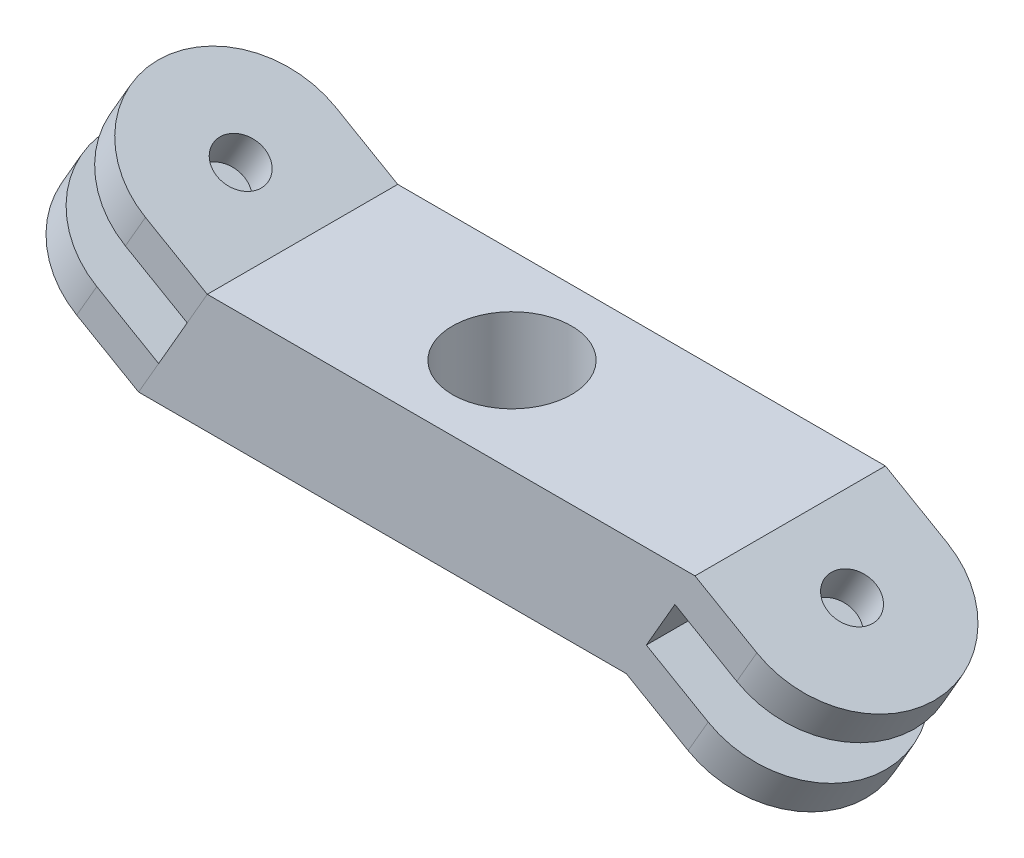
from build123d import *

# Parameters (mm, degrees)
SKETCH_2_R                     = 6
EXTRUDE_1_DEPTH                = 5
SKETCH_3_R                     = 2.5
CUT_EXTRUDE_1_DEPTH            = 5
SKETCH_4_W                     = 8.617209121
SKETCH_4_H                     = 5
EXTRUDE_2_DEPTH                = 4
SKETCH_5_W                     = 17.690730237
SKETCH_5_H                     = 8.258947269
CUT_EXTRUDE_3_DEPTH            = 4.5
EXTRUDE_3_DEPTH                = 5.773503
CUT_EXTRUDE_START              = -5.773503
SKETCH_7_R                     = 1
CUT_EXTRUDE_4_DEPTH            = 5.773503
SKETCH_9_W                     = 22.757935056
SKETCH_9_H                     = 15.650140619
CUT_EXTRUDE_5_DEPTH            = 1.2
PATTERN_CIRCULAR_3_COUNT       = 2
PATTERN_START                  = 4.400276835
PATTERN_CIRCULAR_4_OUTLINE_R   = 1
PATTERN_CIRCULAR_4_DEPTH       = 1.686751346
PATTERN_START_2                = 8.487028181
PATTERN_CIRCULAR_4_2_OUTLINE_R = 1
PATTERN_CIRCULAR_4_2_DEPTH     = 1.686751346
SKETCH_10_W                    = 9.588589767
SKETCH_10_H                    = 4.25680111
SKETCH_10_W_2                  = 8.94427191
SKETCH_10_H_2                  = 4.682372666
CUT_EXTRUDE_6_DEPTH            = 10


# Read off the part's stored shape, not the designer's step: 阵列(圆周)4
with BuildPart() as part:
    # 草图2 → 凸台-拉伸1 (new body)
    with BuildSketch(Plane(origin=(0, 0, 0), x_dir=(1, 0, 0), z_dir=(0, 1, 0))):
        with Locations(Location((0, 0, 0), (0, 0, 270))):
            Circle(SKETCH_2_R)
    extrude(amount=EXTRUDE_1_DEPTH)

    # 草图3 → 切除-拉伸1 (cut)
    with BuildSketch(Plane(origin=(0, 5, 0), x_dir=(1, 0, 0), z_dir=(0, 1, 0))):
        with Locations(Location((0, 0, 0), (0, 0, 270))):
            Circle(SKETCH_3_R)
    extrude(amount=-CUT_EXTRUDE_1_DEPTH, mode=Mode.SUBTRACT)

    # 草图4 → 凸台-拉伸2 (add, symmetric)
    with BuildSketch(Plane.XY):
        with Locations((-7.378700456, 2.5)):
            Rectangle(SKETCH_4_W, SKETCH_4_H)
    extrude_2 = extrude(amount=EXTRUDE_2_DEPTH, both=True)

    # 草图5 → 切除-拉伸3 (cut)
    with BuildSketch(Plane(origin=(-8.765478763, 5.060751523, 0), x_dir=(0, 0, 1), z_dir=(0.8660254037844398, -0.499999999999998, 0))):
        with Locations((1.152187915, 4.129473635)):
            Rectangle(SKETCH_5_W, SKETCH_5_H)
    cut_extrude_3 = extrude(amount=-CUT_EXTRUDE_3_DEPTH, mode=Mode.SUBTRACT)

    # 镜向1: 凸台-拉伸2 across plane
    add(extrude_2.mirror(Plane(origin=(0, 0, 0), x_dir=(0, 0, 1), z_dir=(1, 0, 0))))

    # 阵列(圆周)3: 切除-拉伸3 ×2 about axis
    pattern_circular_3_axis = Axis((0, 2.5, -9.079549455), (0, 0, 1))
    for i in range(1, PATTERN_CIRCULAR_3_COUNT):
        add(cut_extrude_3.rotate(pattern_circular_3_axis, i * 360 / PATTERN_CIRCULAR_3_COUNT), mode=Mode.SUBTRACT)

    # 阵列(圆周)4 outline → 阵列(圆周)4 (add)
    with BuildSketch(Plane(origin=(0, 0, 0), x_dir=(0.8660254037844398, -0.499999999999998, 0), z_dir=(0.49999999999999795, 0.8660254037844399, 0)).offset(PATTERN_START)):
        with BuildLine():
            Line((10.621503046, 4), (7.621503046, 4))
            Line((7.621503046, 4), (7.621503046, -4))
            Line((7.621503046, -4), (10.621503046, -4))
            ThreePointArc((10.621503046, -4), (14.621503046, 0), (10.621503046, 4))
        make_face()
        with Locations((10.621503046, 0)):
            Circle(PATTERN_CIRCULAR_4_OUTLINE_R, mode=Mode.SUBTRACT)
    extrude(amount=PATTERN_CIRCULAR_4_DEPTH)

    # Pattern Circular 4 2 outline → Pattern Circular 4 2 (add)
    with BuildSketch(Plane(origin=(0, 0, 0), x_dir=(0.8660254037844398, -0.499999999999998, 0), z_dir=(0.49999999999999795, 0.8660254037844399, 0)).offset(PATTERN_START_2)):
        with BuildLine():
            Line((10.621503046, 4), (7.621503046, 4))
            Line((7.621503046, 4), (7.621503046, -4))
            Line((7.621503046, -4), (10.621503046, -4))
            ThreePointArc((10.621503046, -4), (14.621503046, 0), (10.621503046, 4))
        make_face()
        with Locations((10.621503046, 0)):
            Circle(PATTERN_CIRCULAR_4_2_OUTLINE_R, mode=Mode.SUBTRACT)
    extrude(amount=PATTERN_CIRCULAR_4_2_DEPTH)

    # 草图10 → 切除-拉伸6 (cut)
    with BuildSketch(Plane(origin=(0, 5, 0), x_dir=(1, 0, 0), z_dir=(0, 1, 0))):
        with Locations((-0.322158928, -6.128400555)):
            Rectangle(SKETCH_10_W, SKETCH_10_H)
        with Locations((0, 6.341186333)):
            Rectangle(SKETCH_10_W_2, SKETCH_10_H_2)
    extrude(amount=-CUT_EXTRUDE_6_DEPTH, mode=Mode.SUBTRACT)


with BuildPart() as body_2:
    # 草图6 → 凸台-拉伸3 (new body)
    with BuildSketch(Plane(origin=(-0.035074908, -0.060751523, 0), x_dir=(0, 0, 1), z_dir=(0.499999999999998, 0.8660254037844398, 0))):
        with BuildLine():
            Line((-4, -13.121503046), (-4, -10.121503046))
            Line((-4, -10.121503046), (4, -10.121503046))
            Line((4, -10.121503046), (4, -13.121503046))
            ThreePointArc((4, -13.121503046), (0, -17.121503046), (-4, -13.121503046))
        make_face()
    extrude(amount=-EXTRUDE_3_DEPTH)

    # 草图7 → 切除-拉伸4 (cut)
    with BuildSketch(Plane(origin=(-0.035074908, -0.060751523, 0), x_dir=(0.8660254037844398, -0.49999999999999806, 0), z_dir=(0.499999999999998, 0.8660254037844397, 0)).offset(CUT_EXTRUDE_START)):
        with Locations(Location((-13.121503046, 0, 0), (0, 0, 180))):
            Circle(SKETCH_7_R)
    extrude(amount=CUT_EXTRUDE_4_DEPTH, mode=Mode.SUBTRACT)

    # 草图9 → 切除-拉伸5 (cut, symmetric)
    with BuildSketch(Plane(origin=(-1.478450581, -2.560751523, 0), x_dir=(0.8660254037844398, -0.49999999999999806, 0), z_dir=(0.499999999999998, 0.8660254037844397, 0))):
        with Locations((-20.577581029, 0.471972115)):
            Rectangle(SKETCH_9_W, SKETCH_9_H)
    extrude(amount=CUT_EXTRUDE_5_DEPTH, both=True, mode=Mode.SUBTRACT)


with BuildPart() as cut_extrude_5_piece_1:
    # of the separate pieces the step leaves, piece 1, a body of its own (cut_extrude_5_pieces)
    add(body_2.part.solids().sort_by_distance((-10.843929344, 1.460769515, -4))[0])


with BuildPart() as cut_extrude_5_piece_2:
    # of the separate pieces the step leaves, piece 2, a body of its own (cut_extrude_5_pieces)
    add(body_2.part.solids().sort_by_distance((-11.398629882, 6.5, -4))[0])


solid = Compound([part.part, cut_extrude_5_piece_1.part, cut_extrude_5_piece_2.part])
